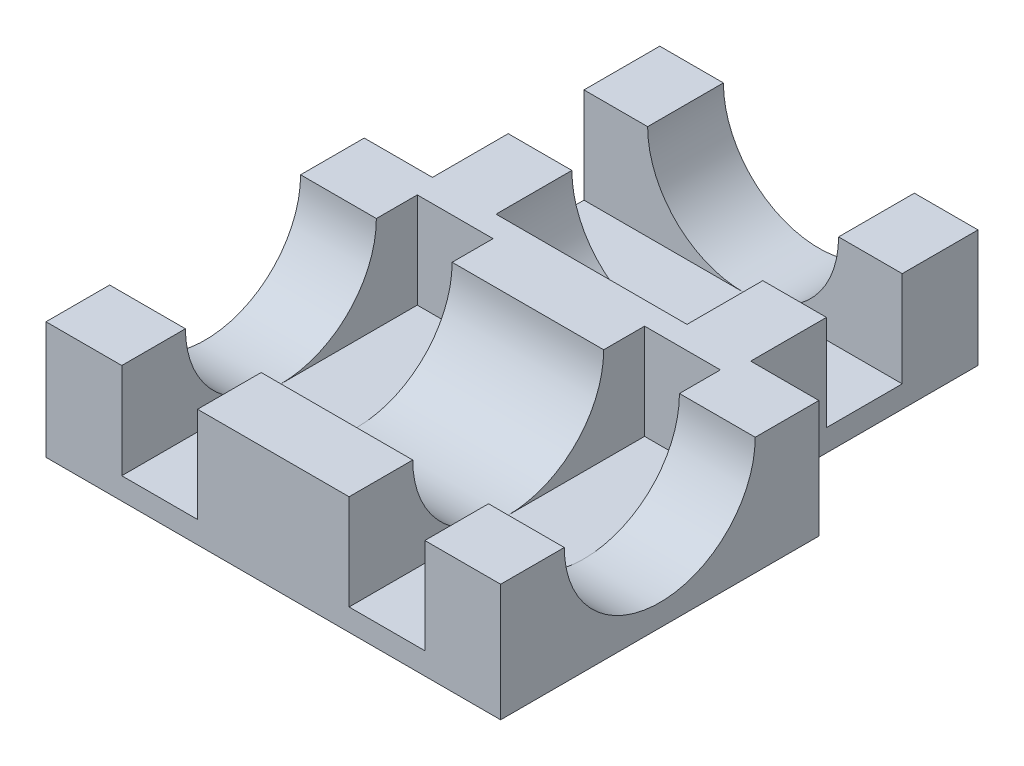
from build123d import *

# Parameters (mm, degrees)
EXTRUDE_1_DEPTH     = 15.5
CUT_EXTRUDE_1_DEPTH = 95.99605255
CUT_EXTRUDE_2_DEPTH = 30
SKETCH_4_W          = 10
SKETCH_4_H          = 12.6
CUT_EXTRUDE_3_DEPTH = 90.583759689
SKETCH_5_W          = 10
SKETCH_5_H          = 12.6
CUT_EXTRUDE_4_DEPTH = 39


with BuildPart() as part:
    # Эскиз1 → Бобышка-Вытянуть1 (new body)
    with BuildSketch(Plane(origin=(0, 0, 0), x_dir=(1, 0, 0), z_dir=(0, 1, 0))):
        Polygon((0, 8.4), (0, 0), (60, 0), (60, 42), (51, 42), (51, 72), (9, 72), (9, 42), (0, 42), (0, 33.6), align=None)
    extrude(amount=EXTRUDE_1_DEPTH)

    # Эскиз2 → Вырез-Вытянуть1 (cut, through all)
    with BuildSketch(Plane.ZY):
        with BuildLine():
            Line((-33.6, 15.5), (-8.4, 15.5))
            ThreePointArc((-8.4, 15.5), (-21, 2.9), (-33.6, 15.5))
        make_face()
    extrude(amount=-CUT_EXTRUDE_1_DEPTH, mode=Mode.SUBTRACT)

    # Эскиз3 → Вырез-Вытянуть2 (cut)
    with BuildSketch(Plane(origin=(0, 0, -72), x_dir=(-1, 0, 0), z_dir=(0, 0, -1))):
        with BuildLine():
            Line((-42.6, 15.5), (-17.4, 15.5))
            ThreePointArc((-17.4, 15.5), (-30, 2.9), (-42.6, 15.5))
        make_face()
    extrude(amount=-CUT_EXTRUDE_2_DEPTH, mode=Mode.SUBTRACT)

    # Эскиз4 → Вырез-Вытянуть3 (cut, through all)
    with BuildSketch(Plane(origin=(51, 0, 0), x_dir=(0, 0, -1), z_dir=(1, 0, 0))):
        with Locations((57, 9.2)):
            Rectangle(SKETCH_4_W, SKETCH_4_H)
    extrude(amount=-CUT_EXTRUDE_3_DEPTH, mode=Mode.SUBTRACT)

    # Эскиз5 → Вырез-Вытянуть4 (cut)
    with BuildSketch(Plane.XY):
        with Locations((15, 9.2)):
            Rectangle(SKETCH_5_W, SKETCH_5_H)
        with Locations((45, 9.2)):
            Rectangle(SKETCH_5_W, SKETCH_5_H)
    extrude(amount=-CUT_EXTRUDE_4_DEPTH, mode=Mode.SUBTRACT)


solid = part.part
